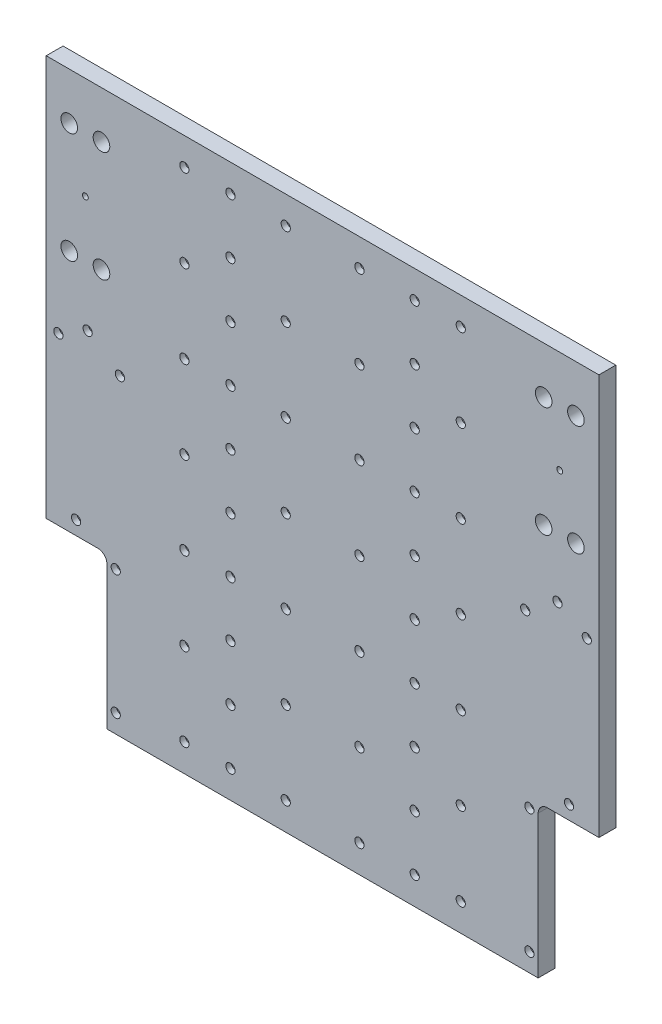
from build123d import *

# Parameters (mm, degrees)
SKETCH1_W                      = 600
SKETCH1_H                      = 600
BOSS_EXTRUDE1_DEPTH            = 18.3
SKETCH2_W                      = 65.95
SKETCH2_H                      = 165
CUT_EXTRUDE1_DEPTH             = 425.658556961
FILLET1_R                      = 10
SKETCH5_R                      = 9.017
SKETCH5_R_2                    = 3.175
CUT_EXTRUDE2_DEPTH             = 425.658556961
CBORE_FOR_M5_SHCS1_D           = 5.5
CBORE_FOR_M5_SHCS1_DEPTH       = 28.347633298
CBORE_FOR_M5_SHCS1_CBORE_D     = 10
CBORE_FOR_M5_SHCS1_CBORE_DEPTH = 6
CBORE_FOR_M5_SHCS1_TIP         = 1.652366702
SKETCH8_R                      = 3.175
CUT_EXTRUDE3_DEPTH             = 425.658556961


with BuildPart() as part:
    # Sketch1 → Boss-Extrude1 (new body)
    with BuildSketch(Plane.XY):
        Rectangle(SKETCH1_W, SKETCH1_H)
    extrude(amount=BOSS_EXTRUDE1_DEPTH)

    # Sketch2 → Cut-Extrude1 (cut, through all)
    with BuildSketch(Plane(origin=(0, 0, 0), x_dir=(-1, 0, 0), z_dir=(0, 0, -1))):
        with Locations((267.025, -217.5)):
            Rectangle(SKETCH2_W, SKETCH2_H)
        with Locations((-267.025, -217.5)):
            Rectangle(SKETCH2_W, SKETCH2_H)
    extrude(amount=-CUT_EXTRUDE1_DEPTH, mode=Mode.SUBTRACT)

    # Fillet1
    fillet1_edges = [part.edges().sort_by_distance(p)[0] for p in [
        (-234.05, -135, 9.15),
        (234.05, -135, 9.15),
    ]]
    fillet(fillet1_edges, radius=FILLET1_R)

    # Sketch5 → Cut-Extrude2 (cut, through all)
    with BuildSketch(Plane(origin=(0, 0, 0), x_dir=(-1, 0, 0), z_dir=(0, 0, -1))):
        with Locations((240, 249)):
            Circle(SKETCH5_R)
        with Locations((275, 249)):
            Circle(SKETCH5_R)
        with Locations((257.5, 189)):
            Circle(SKETCH5_R_2)
        with Locations((275, 129)):
            Circle(SKETCH5_R)
        with Locations((240, 129)):
            Circle(SKETCH5_R)
        with Locations((-275, 129)):
            Circle(SKETCH5_R)
        with Locations((-240, 129)):
            Circle(SKETCH5_R)
        with Locations((-257.5, 189)):
            Circle(SKETCH5_R_2)
        with Locations((-275, 249)):
            Circle(SKETCH5_R)
        with Locations((-240, 249)):
            Circle(SKETCH5_R)
    extrude(amount=-CUT_EXTRUDE2_DEPTH, mode=Mode.SUBTRACT)

    # CBORE for M5 SHCS1
    with Locations(Plane.XY.offset(18.3)):
        with Locations((-100, 210), (-100, 270), (100, 270), (100, 210), (100, 150), (-100, 150), (-100, 90), (100, 90), (100, 30), (-100, 30), (-255, 64), (-220, 39), (255, 64), (220, 39), (100, -30), (-100, -30), (-100, -90), (100, -90), (100, -150), (-100, -150), (-100, -210), (100, -210), (100, -270), (-100, -270), (150, -270), (150, -180), (150, -90), (150, 0), (150, 90), (150, 180), (150, 270), (40, 270), (40, 180), (-40, 180), (-40, 270), (-150, 270), (-150, 180), (-150, 90), (-40, 90), (40, 90), (40, 0), (-40, 0), (-40, -90), (40, -90), (-150, -90), (-150, 0), (-150, -180), (-150, -270), (-40, -270), (-40, -180), (40, -180), (40, -270), (224.525, -280), (224.525, -145), (-224.525, -145), (-224.525, -280), (-267.5, -120), (-286.823374453, 45.715728753), (286.823374453, 45.715728753), (267.5, -120)):
            CounterBoreHole(CBORE_FOR_M5_SHCS1_D / 2, CBORE_FOR_M5_SHCS1_CBORE_D / 2, CBORE_FOR_M5_SHCS1_CBORE_DEPTH, depth=CBORE_FOR_M5_SHCS1_DEPTH)
            with Locations((0, 0, -(CBORE_FOR_M5_SHCS1_DEPTH + CBORE_FOR_M5_SHCS1_TIP / 2))):  # 118° drill point
                Cone(0, CBORE_FOR_M5_SHCS1_D / 2, CBORE_FOR_M5_SHCS1_TIP, mode=Mode.SUBTRACT)

    # Sketch8 → Cut-Extrude3 (cut, through all)
    with BuildSketch(Plane.XY.offset(18.3)):
        with Locations((-40, 0)):
            Circle(SKETCH8_R)
        with Locations((40, 0)):
            Circle(SKETCH8_R)
    extrude(amount=-CUT_EXTRUDE3_DEPTH, mode=Mode.SUBTRACT)


solid = part.part
